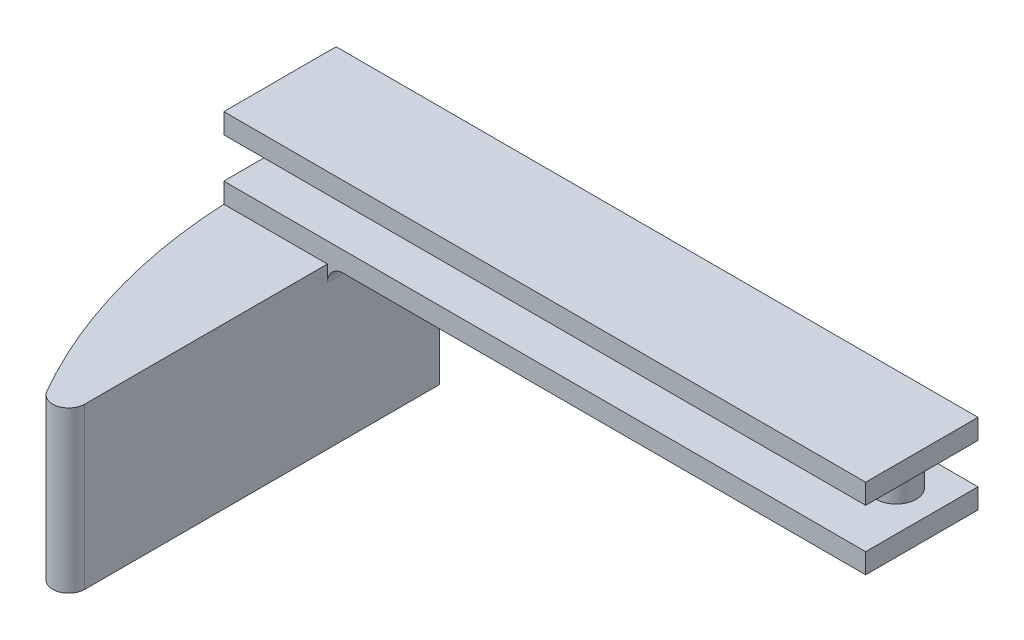
from build123d import *

# Parameters (mm, degrees)
SKETCH2_W           = 101.6
SKETCH2_H           = 17.78
BOSS_EXTRUDE1_DEPTH = 3.175
BOSS_EXTRUDE2_DEPTH = 6.35
BOSS_EXTRUDE3_DEPTH = 25.4
FILLET1_R           = 2.54
FILLET2_R           = 2.54


with BuildPart() as part:
    # Sketch2 → Boss-Extrude1 (new body)
    with BuildSketch(Plane(origin=(0, 0, 0), x_dir=(1, 0, 0), z_dir=(0, 1, 0))):
        with Locations((50.8, 8.89)):
            Rectangle(SKETCH2_W, SKETCH2_H)
    boss_extrude1 = extrude(amount=BOSS_EXTRUDE1_DEPTH)

    # Sketch3 → Boss-Extrude2 (add)
    with BuildSketch(Plane.XZ):
        with BuildLine():
            Line((95.25, -14.351), (6.35, -14.351))
            ThreePointArc((6.35, -14.351), (3.175, -11.176), (6.35, -8.001))
            Line((6.35, -8.001), (95.25, -8.001))
            ThreePointArc((95.25, -8.001), (98.425, -11.176), (95.25, -14.351))
        make_face()
    extrude(amount=BOSS_EXTRUDE2_DEPTH)

    # Mirror1: Boss-Extrude1 across plane
    add(boss_extrude1.mirror(Plane(origin=(0, -3.175, 0), x_dir=(0, 0, 1), z_dir=(0, -1, 0))))

    # Sketch4 → Boss-Extrude3 (add)
    with BuildSketch(Plane.XZ.offset(9.525)):
        with BuildLine():
            Line((0, -17.78), (16.393849753, -17.78))
            Line((16.393849753, -17.78), (16.393849753, 0))
            Line((16.393849753, 0), (16.393849753, 47.008966697))
            ThreePointArc((16.393849753, 47.008966697), (4.7870119, 24.693652244), (0, 0))
            Line((0, 0), (0, -17.78))
        make_face()
    extrude(amount=BOSS_EXTRUDE3_DEPTH)

    # Fillet1
    fillet1_edges = [part.edges().sort_by_distance(p)[0] for p in [
        (16.393849753, -9.525, -8.89),
    ]]
    fillet(fillet1_edges, radius=FILLET1_R)

    # Fillet2
    fillet2_edges = [part.edges().sort_by_distance(p)[0] for p in [
        (16.393849753, -22.225, 47.008966697),
    ]]
    fillet(fillet2_edges, radius=FILLET2_R)


solid = part.part
